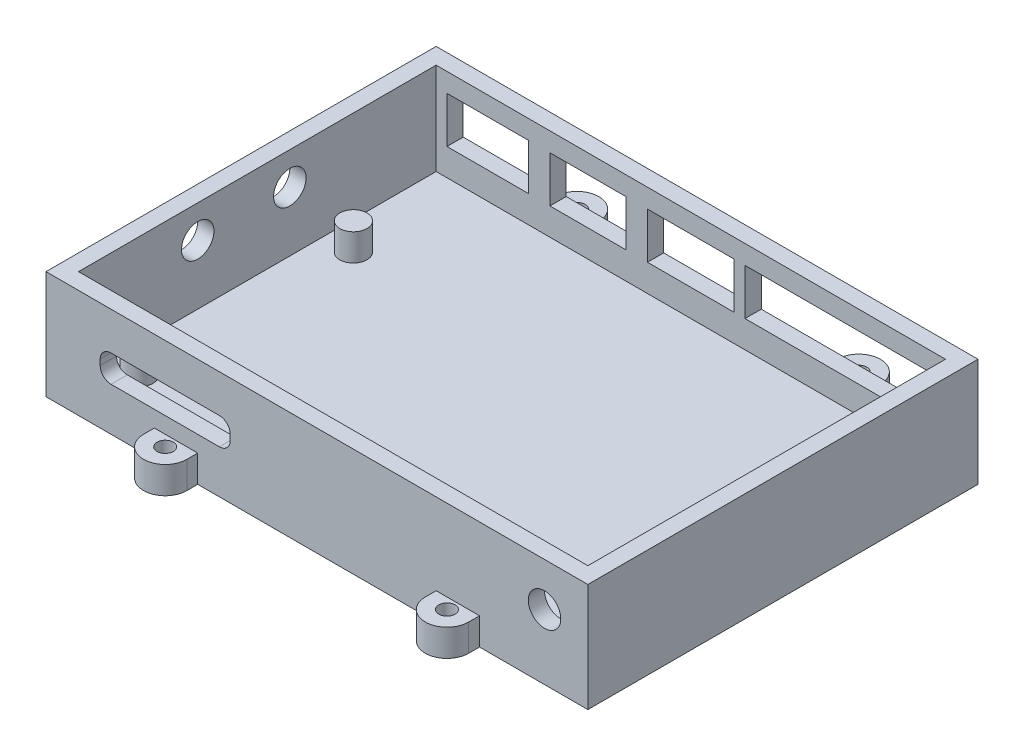
from build123d import *

# Parameters (mm, degrees)
SKETCH1_W            = 100
SKETCH1_H            = 72
BOSS_EXTRUDE1_DEPTH  = 20
SKETCH2_W            = 94
SKETCH2_H            = 66
CUT_EXTRUDE1_DEPTH   = 17
SKETCH3_R            = 2.5
BOSS_EXTRUDE2_DEPTH  = 5
SKETCH6_W            = 36
SKETCH6_H            = 8.5
SKETCH6_W_2          = 14
SKETCH6_W_3          = 16
SKETCH6_W_4          = 15
BOSS_EXTRUDE4_DEPTH  = 12
SKETCH6_6_W          = 36
SKETCH6_6_H          = 8.5
SKETCH6_6_W_2        = 14
SKETCH6_6_W_3        = 16
SKETCH6_6_W_4        = 15
CUT_EXTRUDE2_DEPTH   = 18
CUT_EXTRUDE4_DEPTH   = 18
ANT1_HOLE_R          = 3
CUT_EXTRUDE5_DEPTH   = 10
ANT2_HOLE_R          = 3
CUT_EXTRUDE6_DEPTH   = 10
RESET_HOLE_R         = 3
CUT_EXTRUDE8_DEPTH   = 6
LUG1_R               = 1.5
BOSS_EXTRUDE10_DEPTH = 5
LUG2_R               = 1.5
BOSS_EXTRUDE11_DEPTH = 5
LUG3_R               = 1.5
BOSS_EXTRUDE12_DEPTH = 5
LUG4_R               = 1.5
BOSS_EXTRUDE13_DEPTH = 5


with BuildPart() as part:
    # Sketch1 → Boss-Extrude1 (new body)
    with BuildSketch(Plane(origin=(0, 0, 0), x_dir=(1, 0, 0), z_dir=(0, 1, 0))):
        with Locations((0.803212851, 7.285140562)):
            Rectangle(SKETCH1_W, SKETCH1_H)
    extrude(amount=BOSS_EXTRUDE1_DEPTH)

    # Sketch2 → Cut-Extrude1 (cut)
    with BuildSketch(Plane(origin=(0, 20, 0), x_dir=(1, 0, 0), z_dir=(0, 1, 0))):
        with Locations((0.803212851, 7.285140562)):
            Rectangle(SKETCH2_W, SKETCH2_H)
    extrude(amount=-CUT_EXTRUDE1_DEPTH, mode=Mode.SUBTRACT)

    # Sketch3 → Boss-Extrude2 (add)
    with BuildSketch(Plane(origin=(0, 3, 0), x_dir=(1, 0, 0), z_dir=(0, 1, 0))):
        with Locations((-40.962789341, -19.714859438)):
            Circle(SKETCH3_R)
        with Locations((-40.962789341, 19.785140562)):
            Circle(SKETCH3_R)
        with Locations((43.037210659, -17.714859438)):
            Circle(SKETCH3_R)
        with Locations((43.037210659, 19.785140562)):
            Circle(SKETCH3_R)
    extrude(amount=BOSS_EXTRUDE2_DEPTH)

    # Sketch6 → Boss-Extrude4 (add)
    with BuildSketch(Plane(origin=(0, 0, -43.285140562), x_dir=(-1, 0, 0), z_dir=(0, 0, -1))):
        with Locations((-28.803212851, 12.25)):
            Rectangle(SKETCH6_W, SKETCH6_H)
        with Locations((18.196787149, 12.25)):
            Rectangle(SKETCH6_W_2, SKETCH6_H)
        with Locations((-0.803212851, 12.25)):
            Rectangle(SKETCH6_W_3, SKETCH6_H)
        with Locations((36.696787149, 12.25)):
            Rectangle(SKETCH6_W_4, SKETCH6_H)
    extrude(amount=-BOSS_EXTRUDE4_DEPTH)

    # Sketch6<6> → Cut-Extrude2 (cut)
    with BuildSketch(Plane(origin=(0, 0, -43.285140562), x_dir=(-1, 0, 0), z_dir=(0, 0, -1))):
        with Locations((-28.803212851, 12.25)):
            Rectangle(SKETCH6_6_W, SKETCH6_6_H)
        with Locations((18.196787149, 12.25)):
            Rectangle(SKETCH6_6_W_2, SKETCH6_6_H)
        with Locations((-0.803212851, 12.25)):
            Rectangle(SKETCH6_6_W_3, SKETCH6_6_H)
        with Locations((36.696787149, 12.25)):
            Rectangle(SKETCH6_6_W_4, SKETCH6_6_H)
    extrude(amount=-CUT_EXTRUDE2_DEPTH, mode=Mode.SUBTRACT)

    # usb type-c → Cut-Extrude4 (cut)
    with BuildSketch(Plane.XY.offset(28.714859438)):
        with BuildLine():
            Line((-37.196787149, 13), (-17.196787149, 13))
            ThreePointArc((-17.196787149, 13), (-15.782573586, 12.414213562), (-15.196787149, 11))
            Line((-15.196787149, 11), (-15.196787149, 10))
            ThreePointArc((-15.196787149, 10), (-15.782573586, 8.585786438), (-17.196787149, 8))
            Line((-17.196787149, 8), (-37.196787149, 8))
            ThreePointArc((-37.196787149, 8), (-38.611000711, 8.585786438), (-39.196787149, 10))
            Line((-39.196787149, 10), (-39.196787149, 11))
            ThreePointArc((-39.196787149, 11), (-38.611000711, 12.414213562), (-37.196787149, 13))
        make_face()
    extrude(amount=-CUT_EXTRUDE4_DEPTH, mode=Mode.SUBTRACT)

    # ant1-hole → Cut-Extrude5 (cut)
    with BuildSketch(Plane.ZY.offset(49.196787149)):
        with Locations((-13.285140562, 14)):
            Circle(ANT1_HOLE_R)
    extrude(amount=-CUT_EXTRUDE5_DEPTH, mode=Mode.SUBTRACT)

    # ant2-hole → Cut-Extrude6 (cut)
    with BuildSketch(Plane.ZY.offset(49.196787149)):
        with Locations((3.714859438, 14)):
            Circle(ANT2_HOLE_R)
    extrude(amount=-CUT_EXTRUDE6_DEPTH, mode=Mode.SUBTRACT)

    # reset-hole → Cut-Extrude8 (cut)
    with BuildSketch(Plane.XY.offset(28.714859438)):
        with Locations((42.803212851, 12)):
            Circle(RESET_HOLE_R)
    extrude(amount=-CUT_EXTRUDE8_DEPTH, mode=Mode.SUBTRACT)

    # lug1 → Boss-Extrude10 (add)
    with BuildSketch(Plane(origin=(0, 0, 0), x_dir=(1, 0, 0), z_dir=(0, 1, 0))):
        with BuildLine():
            Line((-29.196787149, -28.714859438), (-29.196787149, -30.714859438))
            ThreePointArc((-29.196787149, -30.714859438), (-25.196787149, -34.714859438), (-21.196787149, -30.714859438))
            Line((-21.196787149, -30.714859438), (-21.196787149, -28.714859438))
            Line((-21.196787149, -28.714859438), (-29.196787149, -28.714859438))
        make_face()
        with Locations((-25.196787149, -30.714859438)):
            Circle(LUG1_R, mode=Mode.SUBTRACT)
    extrude(amount=BOSS_EXTRUDE10_DEPTH)

    # lug2 → Boss-Extrude11 (add)
    with BuildSketch(Plane(origin=(0, 0, 0), x_dir=(1, 0, 0), z_dir=(0, 1, 0))):
        with BuildLine():
            Line((22.803212851, -28.714859438), (22.803212851, -30.714859438))
            ThreePointArc((22.803212851, -30.714859438), (26.803212851, -34.714859438), (30.803212851, -30.714859438))
            Line((30.803212851, -30.714859438), (30.803212851, -28.714859438))
            Line((30.803212851, -28.714859438), (22.803212851, -28.714859438))
        make_face()
        with Locations((26.803212851, -30.714859438)):
            Circle(LUG2_R, mode=Mode.SUBTRACT)
    extrude(amount=BOSS_EXTRUDE11_DEPTH)

    # lug3 → Boss-Extrude12 (add)
    with BuildSketch(Plane(origin=(0, 0, 0), x_dir=(1, 0, 0), z_dir=(0, 1, 0))):
        with BuildLine():
            Line((30.803212851, 43.270916449), (30.803212851, 45.270916449))
            ThreePointArc((30.803212851, 45.270916449), (26.803212851, 49.270916449), (22.803212851, 45.270916449))
            Line((22.803212851, 45.270916449), (22.803212851, 43.270916449))
            Line((22.803212851, 43.270916449), (30.803212851, 43.270916449))
        make_face()
        with Locations((26.803212851, 45.270916449)):
            Circle(LUG3_R, mode=Mode.SUBTRACT)
    extrude(amount=BOSS_EXTRUDE12_DEPTH)

    # lug4 → Boss-Extrude13 (add)
    with BuildSketch(Plane(origin=(0, 0, 0), x_dir=(1, 0, 0), z_dir=(0, 1, 0))):
        with BuildLine():
            Line((-21.196787149, 43.285140562), (-21.196787149, 45.285140562))
            ThreePointArc((-21.196787149, 45.285140562), (-25.196787149, 49.285140562), (-29.196787149, 45.285140562))
            Line((-29.196787149, 45.285140562), (-29.196787149, 43.285140562))
            Line((-29.196787149, 43.285140562), (-21.196787149, 43.285140562))
        make_face()
        with Locations((-25.196787149, 45.285140562)):
            Circle(LUG4_R, mode=Mode.SUBTRACT)
    extrude(amount=BOSS_EXTRUDE13_DEPTH)


solid = part.part
